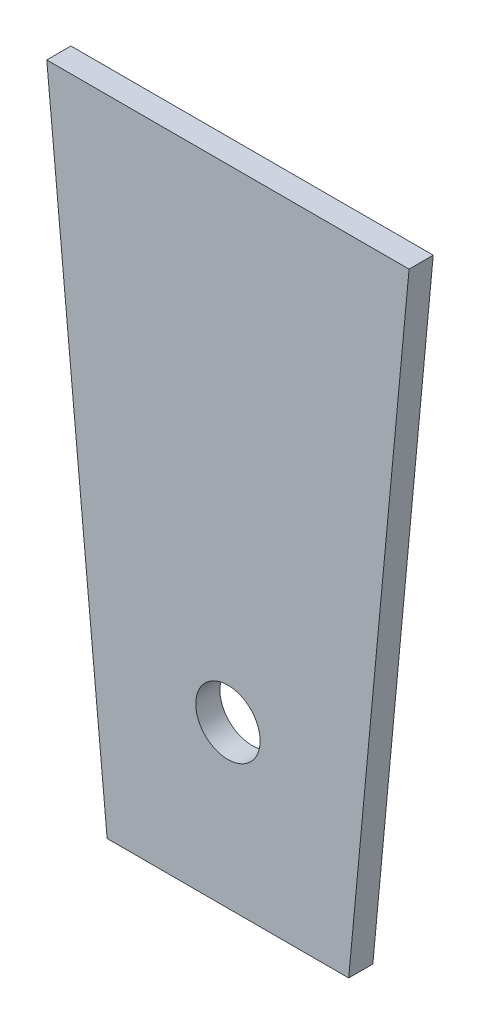
from build123d import *

# Parameters (mm, degrees)
SKETCH1_R           = 4
BOSS_EXTRUDE1_DEPTH = 3


with BuildPart() as part:
    # Sketch1 → Boss-Extrude1 (new body)
    with BuildSketch(Plane.XY):
        Polygon((-22.5, 80), (22.5, 80), (15, 0), (-15, 0), align=None)
        with Locations((0, 20)):
            Circle(SKETCH1_R, mode=Mode.SUBTRACT)
    extrude(amount=BOSS_EXTRUDE1_DEPTH)


solid = part.part
